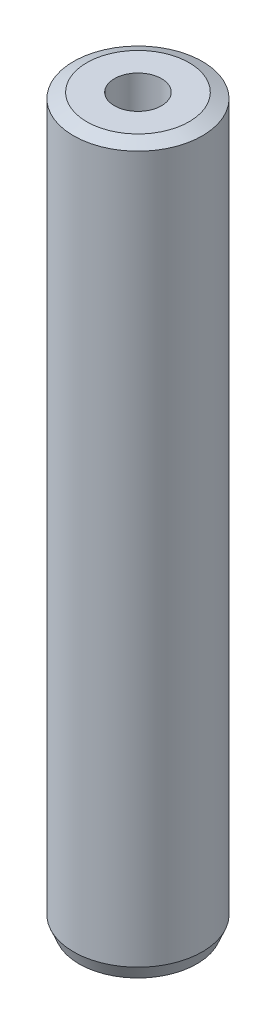
from build123d import *
from OCP.BRepFilletAPI import BRepFilletAPI_MakeChamfer

# Parameters (mm, degrees)
SKETCH1_R           = 47.5
BOSS_EXTRUDE1_DEPTH = 534.769255236
SKETCH2_R           = 17.35362853
CUT_EXTRUDE1_DEPTH  = 539.971851162
CHAMFER1_SIZE       = 4.088820069
CHAMFER1_SIZE2      = 9.774018144


with BuildPart() as part:
    # Sketch1 → Boss-Extrude1 (new body)
    with BuildSketch(Plane(origin=(0, 0, 0), x_dir=(1, 0, 0), z_dir=(0, 1, 0))):
        Circle(SKETCH1_R)
    extrude(amount=BOSS_EXTRUDE1_DEPTH)

    # Sketch2 → Cut-Extrude1 (cut, through all)
    with BuildSketch(Plane(origin=(0, 0, 0), x_dir=(1, 0, 0), z_dir=(0, 1, 0))):
        Circle(SKETCH2_R)
    extrude(amount=CUT_EXTRUDE1_DEPTH, mode=Mode.SUBTRACT)

    # Chamfer1: one chamfer whose edges measure the first distance from different faces: ONE call of the kernel's chamfer builder (chamfer() names one face for all edges)
    chamfer1_edges_1 = [part.edges().sort_by_distance(p)[0] for p in [
        (-47.5, 534.769255236, 0),
    ]]
    chamfer1_side_1 = [part.faces().sort_by_distance(p)[0] for p in [
        (-47.5, 267.384627618, 0),
    ]]
    chamfer1_edges_2 = [part.edges().sort_by_distance(p)[0] for p in [
        (-47.5, 0, 0),
    ]]
    chamfer1_side_2 = [part.faces().sort_by_distance(p)[0] for p in [
        (-46.156497116, 0, 0),
    ]]
    chamfer1 = BRepFilletAPI_MakeChamfer(part.part.solid().wrapped)
    for e in chamfer1_edges_1:
        chamfer1.Add(CHAMFER1_SIZE, CHAMFER1_SIZE2, e.wrapped, chamfer1_side_1[0].wrapped)  # the first distance lies on this face
    for e in chamfer1_edges_2:
        chamfer1.Add(CHAMFER1_SIZE, CHAMFER1_SIZE2, e.wrapped, chamfer1_side_2[0].wrapped)  # the first distance lies on this face
    add(Compound.cast(chamfer1.Shape()), mode=Mode.REPLACE)


solid = part.part
